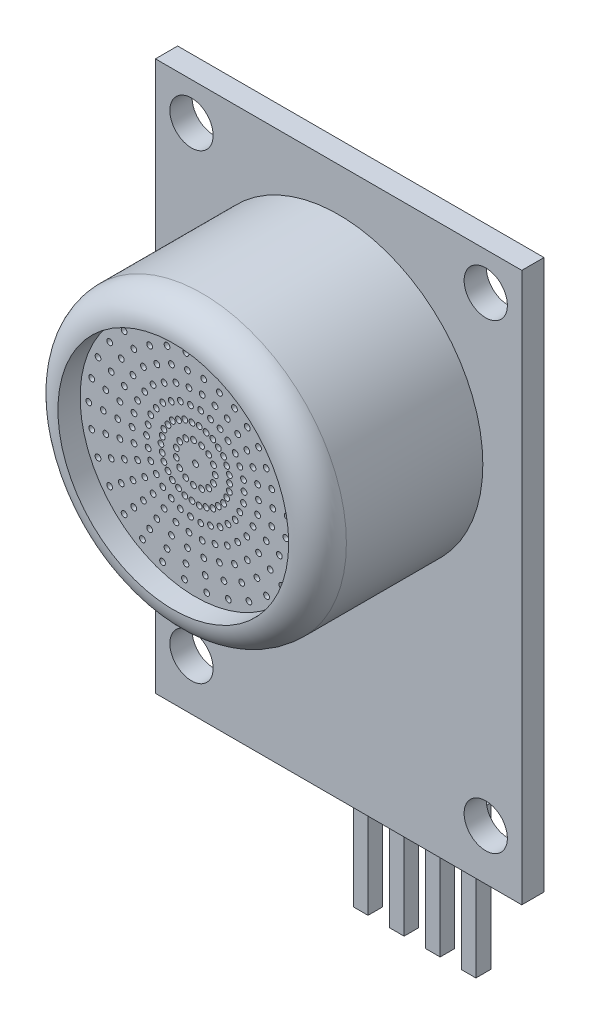
from build123d import *

# Parameters (mm, degrees)
SCHIZZO1_R                   = 10
ESTRUSIONE_ESTRUSIONE4_DEPTH = 13
SCHIZZO1_6_W                 = 25.4
SCHIZZO1_6_H                 = 38.1
SCHIZZO1_6_R                 = 10
ESTRUSIONE_ESTRUSIONE6_DEPTH = 1.54
RACCORDO2_R                  = 2
SCHIZZO4_R                   = 8
TAGLIO_ESTRUSIONE1_DEPTH     = 1.54
FORO_0_4_0_4_2_D             = 0.4
FORO_0_4_0_4_2_DEPTH         = 1
FORO_0_4_0_4_2_TIP           = 0.120172124
FORO_0_4_0_4_3_D             = 0.4
FORO_0_4_0_4_3_DEPTH         = 1
FORO_0_4_0_4_3_TIP           = 0.120172124
FORO_3_0_3_2_D               = 3
FORO_3_0_3_2_DEPTH           = 51
FORO_3_0_3_2_TIP             = 0.901290929
SCHIZZO25_W                  = 2.4
SCHIZZO25_H                  = 2.5
ESTRUSIONE_ESTRUSIONE8_DEPTH = 2
SPESSORE1_START              = -4.8
SPESSORE1_OUTLINE_W          = 1
SPESSORE1_OUTLINE_H          = 10
SPESSORE1_DEPTH              = 1
SPESSORE2_START              = -4.820833333
SPESSORE2_OUTLINE_W          = 1
SPESSORE2_OUTLINE_H          = 10
SPESSORE2_DEPTH              = 1.041666666
SPESSORE3_START              = -4.8
SPESSORE3_OUTLINE_W          = 1
SPESSORE3_OUTLINE_H          = 10
SPESSORE3_DEPTH              = 1
SPESSORE4_START              = -4.8
SPESSORE4_OUTLINE_W          = 1
SPESSORE4_OUTLINE_H          = 10
SPESSORE4_DEPTH              = 1
RACCORDO4_R                  = 0.5


# Read off the part's stored shape, not the designer's step: Spessore1, Spessore2, Spessore3, Spessore4
with BuildPart() as part:
    # Schizzo1 → Estrusione-Estrusione4 (new body)
    with BuildSketch(Plane.XY):
        Circle(SCHIZZO1_R)
    extrude(amount=ESTRUSIONE_ESTRUSIONE4_DEPTH)

    # Schizzo1<6> → Estrusione-Estrusione6 (add)
    with BuildSketch(Plane.XY):
        with Locations((0, -6.05)):
            Rectangle(SCHIZZO1_6_W, SCHIZZO1_6_H)
        Circle(SCHIZZO1_6_R, mode=Mode.SUBTRACT)
    extrude(amount=ESTRUSIONE_ESTRUSIONE6_DEPTH)

    # Raccordo2
    raccordo2_edges = [part.edges().sort_by_distance(p)[0] for p in [
        (-10, 0, 13),
    ]]
    fillet(raccordo2_edges, radius=RACCORDO2_R)

    # Schizzo4 → Taglio-Estrusione1 (cut)
    with BuildSketch(Plane.XY.offset(13)):
        Circle(SCHIZZO4_R)
    extrude(amount=-TAGLIO_ESTRUSIONE1_DEPTH, mode=Mode.SUBTRACT)

    # Foro Ø0.4 (0.4)-2
    with Locations(Plane.XY.offset(11.46)):
        with Locations((1.361372338, 0), (2.361372338, 0), (3.361372338, 0), (4.361372338, 0), (5.361372338, 0), (6.361372338, 0), (7.361372338, 0), (1.243675516, -0.553720015), (2.157220973, -0.960456658), (3.070766431, -1.367193301), (3.984311889, -1.773929944), (4.897857346, -2.180666587), (5.811402804, -2.58740323), (6.724948262, -2.994139873), (0.910935898, -1.011696809), (1.580066504, -1.754841634), (2.249197111, -2.49798646), (2.918327717, -3.241131285), (3.587458324, -3.984276111), (4.25658893, -4.727420936), (4.925719536, -5.470565762), (0.420687188, -1.294742033), (0.729704183, -2.24579855), (1.038721177, -3.196855066), (1.347738171, -4.147911582), (1.656755166, -5.098968099), (1.96577216, -6.050024615), (2.274789154, -7.001081131), (-0.142302158, -1.353914598), (-0.246830622, -2.348436493), (-0.351359085, -3.342958389), (-0.455887548, -4.337480284), (-0.560416012, -5.33200218), (-0.664944475, -6.326524075), (-0.769472938, -7.32104597), (-0.680686169, -1.178983029), (-1.180686169, -2.045008433), (-1.680686169, -2.911033836), (-2.180686169, -3.77705924), (-2.680686169, -4.643084644), (-3.180686169, -5.509110048), (-3.680686169, -6.375135452), (-1.101373357, -0.800194583), (-1.910390352, -1.387979836), (-2.719407346, -1.975765088), (-3.52842434, -2.56355034), (-4.337441335, -3.151335592), (-5.146458329, -3.739120845), (-5.955475324, -4.326906097), (-1.331623086, -0.283045225), (-2.309770687, -0.490956915), (-3.287918288, -0.698868606), (-4.266065889, -0.906780297), (-5.244213489, -1.114691988), (-6.22236109, -1.322603679), (-7.200508691, -1.53051537), (-1.331623086, 0.283045225), (-2.309770687, 0.490956915), (-3.287918288, 0.698868606), (-4.266065889, 0.906780297), (-5.244213489, 1.114691988), (-6.22236109, 1.322603679), (-7.200508691, 1.53051537), (-1.101373357, 0.800194583), (-1.910390352, 1.387979836), (-2.719407346, 1.975765088), (-3.52842434, 2.56355034), (-4.337441335, 3.151335592), (-5.146458329, 3.739120845), (-5.955475324, 4.326906097), (-0.680686169, 1.178983029), (-1.180686169, 2.045008433), (-1.680686169, 2.911033836), (-2.180686169, 3.77705924), (-2.680686169, 4.643084644), (-3.180686169, 5.509110048), (-3.680686169, 6.375135452), (-0.142302158, 1.353914598), (-0.246830622, 2.348436493), (-0.351359085, 3.342958389), (-0.455887548, 4.337480284), (-0.560416012, 5.33200218), (-0.664944475, 6.326524075), (-0.769472938, 7.32104597), (0.420687188, 1.294742033), (0.729704183, 2.24579855), (1.038721177, 3.196855066), (1.347738171, 4.147911582), (1.656755166, 5.098968099), (1.96577216, 6.050024615), (2.274789154, 7.001081131), (0.910935898, 1.011696809), (1.580066504, 1.754841634), (2.249197111, 2.49798646), (2.918327717, 3.241131285), (3.587458324, 3.984276111), (4.25658893, 4.727420936), (4.925719536, 5.470565762), (1.243675516, 0.553720015), (2.157220973, 0.960456658), (3.070766431, 1.367193301), (3.984311889, 1.773929944), (4.897857346, 2.180666587), (5.811402804, 2.58740323), (6.724948262, 2.994139873), (0, 0)):
            Hole(FORO_0_4_0_4_2_D / 2, depth=FORO_0_4_0_4_2_DEPTH)
            with Locations((0, 0, -(FORO_0_4_0_4_2_DEPTH + FORO_0_4_0_4_2_TIP / 2))):  # 118° drill point
                Cone(0, FORO_0_4_0_4_2_D / 2, FORO_0_4_0_4_2_TIP, mode=Mode.SUBTRACT)

    # Foro Ø0.4 (0.4)-3
    with Locations(Plane.XY.offset(11.46)):
        with Locations((1.2, 2.078460969), (1.7, 2.944486373), (2.2, 3.810511777), (2.7, 4.67653718), (3.2, 5.542562584), (3.7, 6.408587988), (1.941640787, 1.410684606), (2.750657781, 1.998469858), (3.559674775, 2.58625511), (4.36869177, 3.174040362), (5.177708764, 3.761825615), (5.986725758, 4.349610867), (2.347554242, 0.498988058), (3.325701842, 0.706899749), (4.303849443, 0.91481144), (5.281997044, 1.12272313), (6.260144645, 1.330634821), (7.238292245, 1.538546512), (2.347554242, -0.498988058), (3.325701842, -0.706899749), (4.303849443, -0.91481144), (5.281997044, -1.12272313), (6.260144645, -1.330634821), (7.238292245, -1.538546512), (1.941640787, -1.410684606), (2.750657781, -1.998469858), (3.559674775, -2.58625511), (4.36869177, -3.174040362), (5.177708764, -3.761825615), (5.986725758, -4.349610867), (1.2, -2.078460969), (1.7, -2.944486373), (2.2, -3.810511777), (2.7, -4.67653718), (3.2, -5.542562584), (3.7, -6.408587988), (0.250868312, -2.386852549), (0.355396775, -3.381374444), (0.459925238, -4.37589634), (0.564453702, -5.370418235), (0.668982165, -6.36494013), (0.773510628, -7.359462026), (-0.741640786, -2.282535639), (-1.050657781, -3.233592155), (-1.359674775, -4.184648672), (-1.66869177, -5.135705188), (-1.977708764, -6.086761704), (-2.286725758, -7.037818221), (-1.605913455, -1.783547581), (-2.275044062, -2.526692407), (-2.944174668, -3.269837232), (-3.613305274, -4.012982058), (-4.282435881, -4.756126883), (-4.951566487, -5.499271709), (-2.192509098, -0.976167943), (-3.106054556, -1.382904586), (-4.019600014, -1.78964123), (-4.933145471, -2.196377873), (-5.846690929, -2.603114516), (-6.760236387, -3.009851159), (-2.4, 0), (-3.4, 0), (-4.4, 0), (-5.4, 0), (-6.4, 0), (-7.4, 0), (-2.192509098, 0.976167943), (-3.106054556, 1.382904586), (-4.019600014, 1.78964123), (-4.933145471, 2.196377873), (-5.846690929, 2.603114516), (-6.760236387, 3.009851159), (-1.605913455, 1.783547581), (-2.275044062, 2.526692407), (-2.944174668, 3.269837232), (-3.613305274, 4.012982058), (-4.282435881, 4.756126883), (-4.951566487, 5.499271709), (-0.741640786, 2.282535639), (-1.050657781, 3.233592155), (-1.359674775, 4.184648672), (-1.66869177, 5.135705188), (-1.977708764, 6.086761704), (-2.286725758, 7.037818221), (0.250868312, 2.386852549), (0.355396775, 3.381374444), (0.459925238, 4.37589634), (0.564453702, 5.370418235), (0.668982165, 6.36494013), (0.773510628, 7.359462026), (0, 0)):
            Hole(FORO_0_4_0_4_3_D / 2, depth=FORO_0_4_0_4_3_DEPTH)
            with Locations((0, 0, -(FORO_0_4_0_4_3_DEPTH + FORO_0_4_0_4_3_TIP / 2))):  # 118° drill point
                Cone(0, FORO_0_4_0_4_3_D / 2, FORO_0_4_0_4_3_TIP, mode=Mode.SUBTRACT)

    # Foro Ø3.0 (3)-2
    with Locations(Plane.XY.offset(1.54)):
        with Locations((10.2, -21.6), (-10.2, -21.6), (-10.2, 10.4), (10.2, 10.4)):
            Hole(FORO_3_0_3_2_D / 2, depth=FORO_3_0_3_2_DEPTH)
            with Locations((0, 0, -(FORO_3_0_3_2_DEPTH + FORO_3_0_3_2_TIP / 2))):  # 118° drill point
                Cone(0, FORO_3_0_3_2_D / 2, FORO_3_0_3_2_TIP, mode=Mode.SUBTRACT)

    # Schizzo25 → Estrusione-Estrusione8 (add)
    with BuildSketch(Plane(origin=(0, 0, 0), x_dir=(-1, 0, 0), z_dir=(0, 0, -1))):
        with Locations((-1.2, -21.6)):
            Rectangle(SCHIZZO25_W, SCHIZZO25_H)
        with Locations((-3.7, -21.6)):
            Rectangle(SCHIZZO25_W, SCHIZZO25_H)
        with Locations((1.3, -21.6)):
            Rectangle(SCHIZZO25_W, SCHIZZO25_H)
        with Locations((3.8, -21.6)):
            Rectangle(SCHIZZO25_W, SCHIZZO25_H)
    extrude(amount=ESTRUSIONE_ESTRUSIONE8_DEPTH)

    # Raccordo4
    raccordo4_edges = [part.edges().sort_by_distance(p)[0] for p in [
        (4.9, -20.35, -1),
        (4.9, -22.85, -1),
        (2.5, -22.85, -1),
        (2.5, -20.35, -1),
        (2.4, -20.35, -1),
        (2.4, -22.85, -1),
        (0, -22.85, -1),
        (0, -20.35, -1),
        (-0.1, -20.35, -1),
        (-0.1, -22.85, -1),
        (-2.5, -22.85, -1),
        (-2.5, -20.35, -1),
        (-2.6, -20.35, -1),
        (-2.6, -22.85, -1),
        (-5, -22.85, -1),
        (-5, -20.35, -1),
    ]]
    fillet(raccordo4_edges, radius=RACCORDO4_R)


with BuildPart() as body_2:
    # Spessore1 outline → Spessore1 (new body)
    with BuildSketch(Plane.XY.offset(SPESSORE1_START)):
        with Locations((1.2, -31.4)):
            Rectangle(SPESSORE1_OUTLINE_W, SPESSORE1_OUTLINE_H)
    extrude(amount=SPESSORE1_DEPTH)


with BuildPart() as body_3:
    # Spessore2 outline → Spessore2 (new body)
    with BuildSketch(Plane.XY.offset(SPESSORE2_START)):
        with Locations((3.7, -31.4)):
            Rectangle(SPESSORE2_OUTLINE_W, SPESSORE2_OUTLINE_H)
    extrude(amount=SPESSORE2_DEPTH)


with BuildPart() as body_4:
    # Spessore3 outline → Spessore3 (new body)
    with BuildSketch(Plane.XY.offset(SPESSORE3_START)):
        with Locations((-1.3, -31.4)):
            Rectangle(SPESSORE3_OUTLINE_W, SPESSORE3_OUTLINE_H)
    extrude(amount=SPESSORE3_DEPTH)


with BuildPart() as body_5:
    # Spessore4 outline → Spessore4 (new body)
    with BuildSketch(Plane.XY.offset(SPESSORE4_START)):
        with Locations((-3.8, -31.4)):
            Rectangle(SPESSORE4_OUTLINE_W, SPESSORE4_OUTLINE_H)
    extrude(amount=SPESSORE4_DEPTH)


solid = Compound([part.part, body_2.part, body_3.part, body_4.part, body_5.part])
